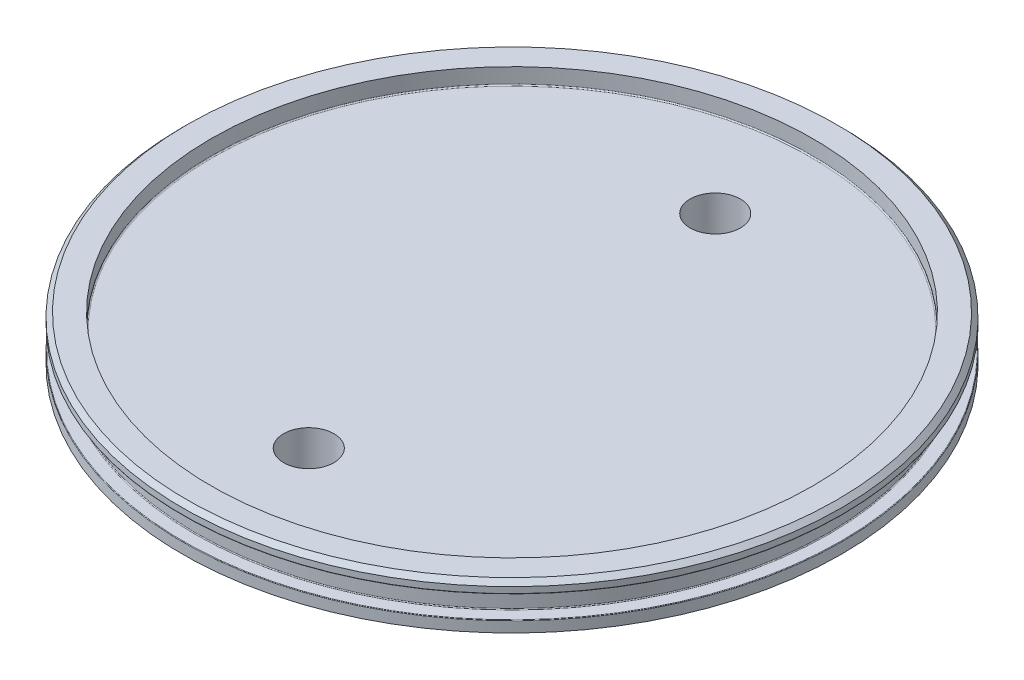
from build123d import *

# Parameters (mm, degrees)
SKETCH6_R                                = 66.04
BOSS_EXTRUDE1_DEPTH                      = 2.54
CNC_ID_FILLET_R                          = 0.1778
CNC_OD_FILLET_R                          = 0.127
CNC_CHAMFERS_SIZE                        = 1.016
CNC_BORE_FILLET_R                        = 0.254
PIPE_TAP_DRILL_FOR_1_4_TAP_RELIEF_VALV_D = 11.1252
PIPE_TAP_DRILL_FOR_1_4_TAP_VENT_VALVE_D  = 11.1252


with BuildPart() as part:
    # Sketch1 → Revolve1 (revolve)
    with BuildSketch(Plane.XY):
        Polygon((0, 0), (72.898, 0), (72.898, 2.4638), (69.977, 2.4638), (69.977, 7.4422), (72.898, 7.4422), (72.898, 9.906), (66.548, 9.906), (66.548, 6.35), (0, 6.35), align=None)
    revolve(axis=Axis((0, 48.192213231, 0), (0, -1, 0)))

    # Sketch6 → Boss-Extrude1 (add)
    with BuildSketch(Plane.XZ):
        Circle(SKETCH6_R)
    extrude(amount=BOSS_EXTRUDE1_DEPTH)

    # CNC ID Fillet
    cnc_id_fillet_edges = [part.edges().sort_by_distance(p)[0] for p in [
        (-69.977, 7.4422, 0),
        (-69.977, 2.4638, 0),
        (-66.04, 0, 0),
    ]]
    fillet(cnc_id_fillet_edges, radius=CNC_ID_FILLET_R)

    # CNC OD Fillet
    cnc_od_fillet_edges = [part.edges().sort_by_distance(p)[0] for p in [
        (-72.898, 7.4422, 0),
        (-72.898, 2.4638, 0),
        (-66.04, -2.54, 0),
    ]]
    fillet(cnc_od_fillet_edges, radius=CNC_OD_FILLET_R)

    # CNC Chamfers
    cnc_chamfers_edges = [part.edges().sort_by_distance(p)[0] for p in [
        (-72.898, 9.906, 0),
    ]]
    chamfer(cnc_chamfers_edges, length=CNC_CHAMFERS_SIZE)

    # CNC Bore Fillet
    cnc_bore_fillet_edges = [part.edges().sort_by_distance(p)[0] for p in [
        (-66.548, 6.35, 0),
    ]]
    fillet(cnc_bore_fillet_edges, radius=CNC_BORE_FILLET_R)

    # Pipe Tap Drill for 1/4 Tap - Relief Valve (through all)
    with Locations(Plane(origin=(0, -2.54, 0), x_dir=(-1, 0, 0), z_dir=(0, -1, 0))):
        with Locations((0, 44.958)):
            Hole(PIPE_TAP_DRILL_FOR_1_4_TAP_RELIEF_VALV_D / 2)

    # Pipe Tap Drill for 1/4 Tap - Vent Valve (through all)
    with Locations(Plane(origin=(0, -2.54, 0), x_dir=(-1, 0, 0), z_dir=(0, -1, 0))):
        with Locations((0, -44.958)):
            Hole(PIPE_TAP_DRILL_FOR_1_4_TAP_VENT_VALVE_D / 2)


solid = part.part
